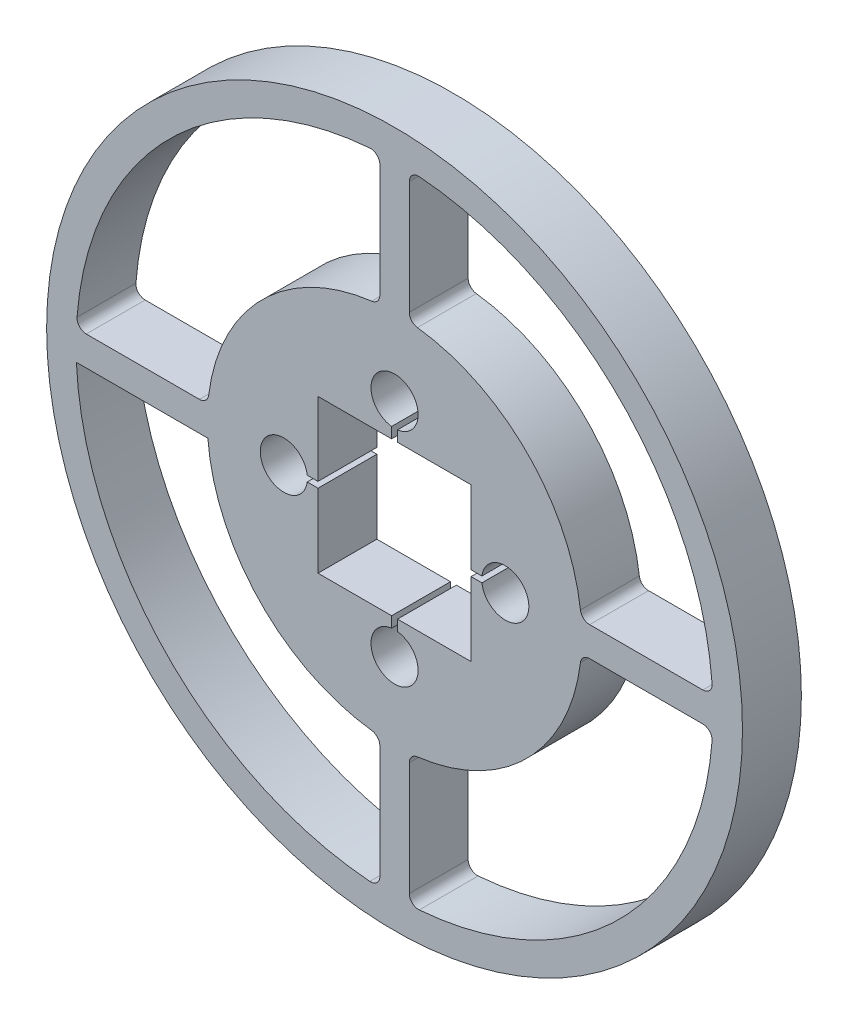
from build123d import *

# Parameters (mm, degrees)
SKETCH1_R           = 37.5158
BOSS_EXTRUDE1_DEPTH = 6.35
FILLET2_R           = 1


with BuildPart() as part:
    # Sketch1 → Boss-Extrude1 (new body)
    with BuildSketch(Plane.XY):
        Circle(SKETCH1_R)
        with BuildLine():
            ThreePointArc((-20.130501552, -1.5875), (-14.278607232, -14.278607232), (-1.5875, -20.130501552))
            Line((-1.5875, -20.130501552), (-1.5875, -34.304087051))
            ThreePointArc((-1.5875, -34.304087051), (-24.282612551, -24.282612551), (-34.304087051, -1.5875))
            Line((-34.304087051, -1.5875), (-20.130501552, -1.5875))
        make_face(mode=Mode.SUBTRACT)
        with BuildLine():
            ThreePointArc((1.5875, -20.130501552), (14.278607232, -14.278607232), (20.130501552, -1.5875))
            Line((20.130501552, -1.5875), (34.304087051, -1.5875))
            ThreePointArc((34.304087051, -1.5875), (24.282612551, -24.282612551), (1.5875, -34.304087051))
            Line((1.5875, -34.304087051), (1.5875, -20.130501552))
        make_face(mode=Mode.SUBTRACT)
        with BuildLine():
            Line((-1.5875, 34.304087051), (-1.5875, 20.130501552))
            ThreePointArc((-1.5875, 20.130501552), (-14.278607232, 14.278607232), (-20.130501552, 1.5875))
            Line((-20.130501552, 1.5875), (-34.304087051, 1.5875))
            ThreePointArc((-34.304087051, 1.5875), (-24.282612551, 24.282612551), (-1.5875, 34.304087051))
        make_face(mode=Mode.SUBTRACT)
        with BuildLine():
            Line((-8.255, 0.3175), (-8.255, 8.255))
            Line((-8.255, 8.255), (-0.3175, 8.255))
            Line((-0.3175, 8.255), (-0.3175, 9.417921876))
            ThreePointArc((-0.3175, 9.417921876), (-1.680052083, 13.843), (2.54, 11.938))
            ThreePointArc((2.54, 11.938), (1.905, 10.257947917), (0.3175, 9.417921876))
            Line((0.3175, 9.417921876), (0.3175, 8.255))
            Line((0.3175, 8.255), (8.255, 8.255))
            Line((8.255, 8.255), (8.255, 0.3175))
            Line((8.255, 0.3175), (9.417921876, 0.3175))
            ThreePointArc((9.417921876, 0.3175), (12.097062198, 2.535014638), (14.478, 0))
            ThreePointArc((14.478, 0), (12.097062198, -2.535014638), (9.417921876, -0.3175))
            Line((9.417921876, -0.3175), (8.255, -0.3175))
            Line((8.255, -0.3175), (8.255, -8.255))
            Line((8.255, -8.255), (0.3175, -8.255))
            Line((0.3175, -8.255), (0.3175, -9.417921876))
            ThreePointArc((0.3175, -9.417921876), (1.905, -10.257947917), (2.54, -11.938))
            ThreePointArc((2.54, -11.938), (-1.680052083, -13.843), (-0.3175, -9.417921876))
            Line((-0.3175, -9.417921876), (-0.3175, -8.255))
            Line((-0.3175, -8.255), (-8.255, -8.255))
            Line((-8.255, -8.255), (-8.255, -0.3175))
            Line((-8.255, -0.3175), (-9.417921876, -0.3175))
            ThreePointArc((-9.417921876, -0.3175), (-14.478, 0), (-9.417921876, 0.3175))
            Line((-9.417921876, 0.3175), (-8.255, 0.3175))
        make_face(mode=Mode.SUBTRACT)
        with BuildLine():
            ThreePointArc((20.130501552, 1.5875), (14.278607232, 14.278607232), (1.5875, 20.130501552))
            Line((1.5875, 20.130501552), (1.5875, 34.304087051))
            ThreePointArc((1.5875, 34.304087051), (24.282612551, 24.282612551), (34.304087051, 1.5875))
            Line((34.304087051, 1.5875), (20.130501552, 1.5875))
        make_face(mode=Mode.SUBTRACT)
    extrude(amount=BOSS_EXTRUDE1_DEPTH)

    # Fillet2
    fillet2_edges = [part.edges().sort_by_distance(p)[0] for p in [
        (1.5875, -34.304087051, 3.175),
        (34.304087051, -1.5875, 3.175),
        (20.130501552, -1.5875, 3.175),
        (1.5875, -20.130501552, 3.175),
        (-1.5875, -20.130501552, 3.175),
        (-1.5875, -34.304087051, 3.175),
        (-20.130501552, 1.5875, 3.175),
        (-1.5875, 20.130501552, 3.175),
        (1.5875, 34.304087051, 3.175),
        (-1.5875, 34.304087051, 3.175),
        (1.5875, 20.130501552, 3.175),
        (20.130501552, 1.5875, 3.175),
        (34.304087051, 1.5875, 3.175),
        (-34.304087051, 1.5875, 3.175),
    ]]
    fillet(fillet2_edges, radius=FILLET2_R)


solid = part.part
